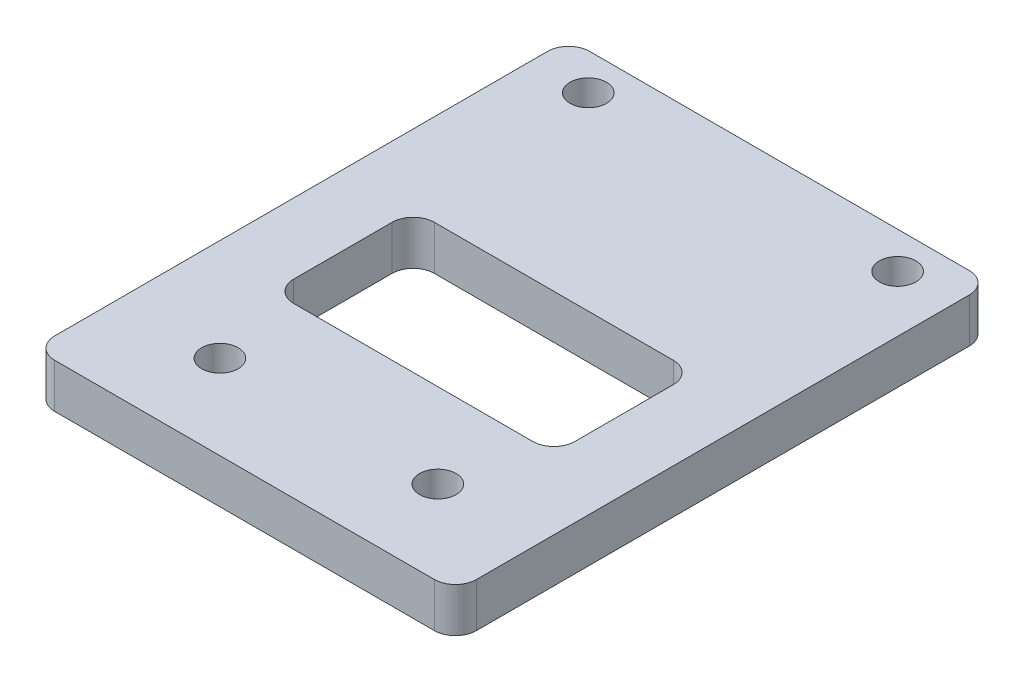
from build123d import *

# Parameters (mm, degrees)
SKETCH1_W           = 30
SKETCH1_H           = 38.05
BOSS_EXTRUDE1_DEPTH = 3.15
CUT_EXTRUDE1_DEPTH  = 25.430986984
SKETCH3_R           = 1.3
CUT_EXTRUDE2_DEPTH  = 25.430986984
FILLET1_R           = 1.5
SKETCH5_R           = 1.3
CUT_EXTRUDE3_DEPTH  = 25.430986984


with BuildPart() as part:
    # Sketch1 → Boss-Extrude1 (new body)
    with BuildSketch(Plane(origin=(0, 0, 0), x_dir=(1, 0, 0), z_dir=(0, 1, 0))):
        Rectangle(SKETCH1_W, SKETCH1_H)
    extrude(amount=-BOSS_EXTRUDE1_DEPTH)

    # Sketch2 → Cut-Extrude1 (cut, through all)
    with BuildSketch(Plane(origin=(0, 0, 0), x_dir=(1, 0, 0), z_dir=(0, 1, 0))):
        with BuildLine():
            Line((-8.5, 2.975), (8.5, 2.975))
            ThreePointArc((8.5, 2.975), (9.560660172, 2.535660172), (10, 1.475))
            Line((10, 1.475), (10, -5.525))
            ThreePointArc((10, -5.525), (9.560660172, -6.585660172), (8.5, -7.025))
            Line((8.5, -7.025), (-8.5, -7.025))
            ThreePointArc((-8.5, -7.025), (-9.560660172, -6.585660172), (-10, -5.525))
            Line((-10, -5.525), (-10, 1.475))
            ThreePointArc((-10, 1.475), (-9.560660172, 2.535660172), (-8.5, 2.975))
        make_face()
    extrude(amount=-CUT_EXTRUDE1_DEPTH, mode=Mode.SUBTRACT)

    # Sketch3 → Cut-Extrude2 (cut, through all)
    with BuildSketch(Plane(origin=(0, 0, 0), x_dir=(1, 0, 0), z_dir=(0, 1, 0))):
        with Locations((-11, 16.425)):
            Circle(SKETCH3_R)
        with Locations((11, 16.425)):
            Circle(SKETCH3_R)
    extrude(amount=-CUT_EXTRUDE2_DEPTH, mode=Mode.SUBTRACT)

    # Fillet1
    fillet1_edges = [part.edges().sort_by_distance(p)[0] for p in [
        (15, -1.575, -19.025),
        (-15, -1.575, -19.025),
        (15, -1.575, 19.025),
        (-15, -1.575, 19.025),
    ]]
    fillet(fillet1_edges, radius=FILLET1_R)

    # Sketch5 → Cut-Extrude3 (cut, through all)
    with BuildSketch(Plane(origin=(0, 0, 0), x_dir=(1, 0, 0), z_dir=(0, 1, 0))):
        with Locations((-7.75, -13.025)):
            Circle(SKETCH5_R)
        with Locations((7.75, -13.025)):
            Circle(SKETCH5_R)
    extrude(amount=-CUT_EXTRUDE3_DEPTH, mode=Mode.SUBTRACT)


solid = part.part
